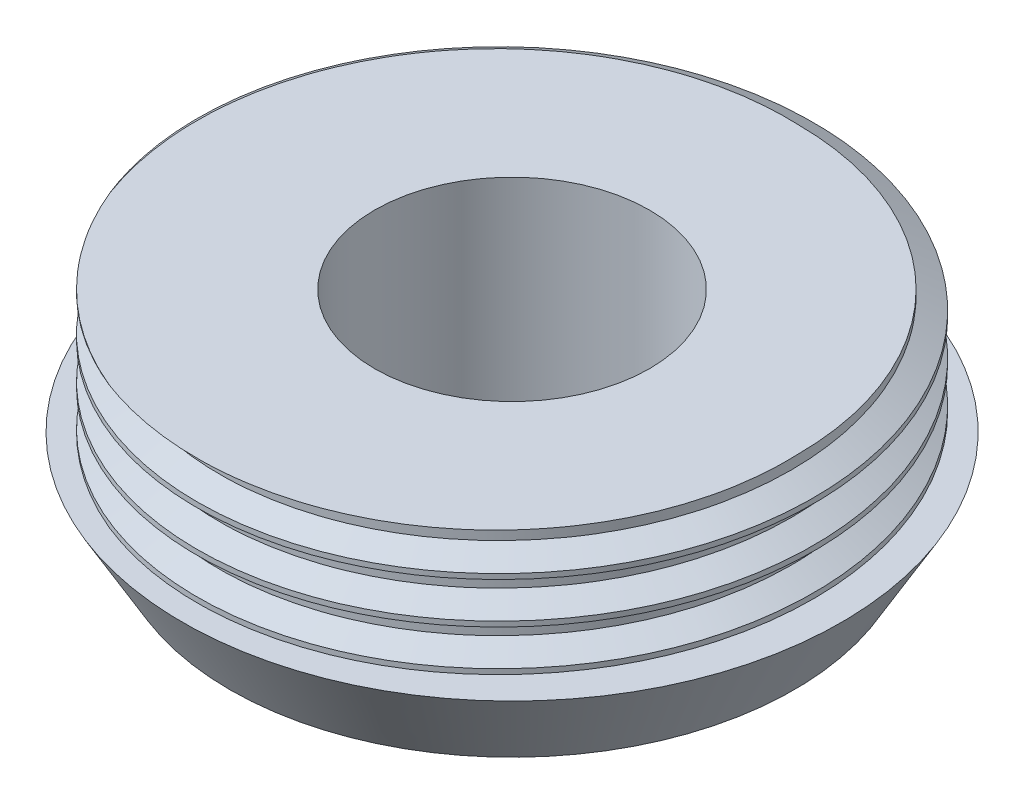
from build123d import *

# Parameters (mm, degrees)
THREAD1_PITCH = 2.116666667
THREAD1_TO    = 8.466667


with BuildPart() as part:
    # Sketch1 → Revolve1 (revolve)
    with BuildSketch(Plane.XY, mode=Mode.PRIVATE) as revolve1_sk:
        Polygon((-14.68501, 0), (-14.68501, 6.35), (-7.06501, 6.35), (-7.06501, -4.22620397), (-14.5, -4.22620397), (-16.94, 0), align=None)
    revolve(revolve1_sk.sketch.rotate(Axis((0, 0, 0), (0, 1, 0)), 270), axis=Axis((0, 0, 0), (0, 1, 0)))

    # Thread1: arcs per turn and ends read off the stored shape
    # Thread1: the profile of Thread Profile1 profile screwed along a right-hand helix through 7 turns, 10 arcs to a turn; built about Z, then put on its axis
    thread1_z = Axis((0, 0, 0), (0, 0, 1))
    thread1_corners = [(14.68471, 0, -0.000173205), (15.830689435, 0, 0.66145833), (15.830689435, 0, 0.926041664), (14.68471, 0, 1.587673199)]
    with BuildLine(mode=Mode.PRIVATE) as thread1_profile:
        Line(thread1_corners[0], thread1_corners[1])
        Line(thread1_corners[1], thread1_corners[2])
        Line(thread1_corners[2], thread1_corners[3])
        Line(thread1_corners[3], thread1_corners[0])
    thread1_cap = Face(thread1_profile.wire())
    thread1_turn_angles = [0, 18, 36, 54, 72, 90, 108, 126, 144, 162, 180, 198, 216, 234, 252, 270, 288, 306, 324, 342, 360]
    thread1_turn_weights = [1, 0.9510565162951535, 1, 0.9510565162951535, 1, 0.9510565162951535, 1, 0.9510565162951535, 1, 0.9510565162951535, 1, 0.9510565162951535, 1, 0.9510565162951535, 1, 0.9510565162951535, 1, 0.9510565162951535, 1, 0.9510565162951535, 1]
    thread1_turn_rails = [Edge.make_bspline([Vector(p[0], p[1], 0).rotate(thread1_z, thread1_turn_angles[k]) / thread1_turn_weights[k] + Vector(0, 0, p[2] + THREAD1_PITCH * thread1_turn_angles[k] / 360) for k in range(21)], [0, 0, 0, 1, 1, 2, 2, 3, 3, 4, 4, 5, 5, 6, 6, 7, 7, 8, 8, 9, 9, 10, 10, 10], 2, thread1_turn_weights) for p in thread1_corners]
    thread1_turn_sides = [Face.make_surface_from_curves(thread1_turn_rails[p[0]], thread1_turn_rails[p[1]]) for p in [(0, 1), (1, 2), (2, 3), (3, 0)]]
    thread1 = Plane(origin=(0, -2.116666582, 0), x_dir=(1, 0, 0), z_dir=(0, 1, 0)) * split(Solid(Shell([*[p.moved(Location((0, 0, THREAD1_PITCH * i))) for i in range(7) for p in thread1_turn_sides], thread1_cap, thread1_cap.rotate(thread1_z, 2520).moved(Location((0, 0, THREAD1_PITCH * 2520 / 360)))])), bisect_by=Plane.XY.offset(THREAD1_TO), keep=Keep.BOTTOM, mode=Mode.PRIVATE)
    add(thread1)


solid = part.part
